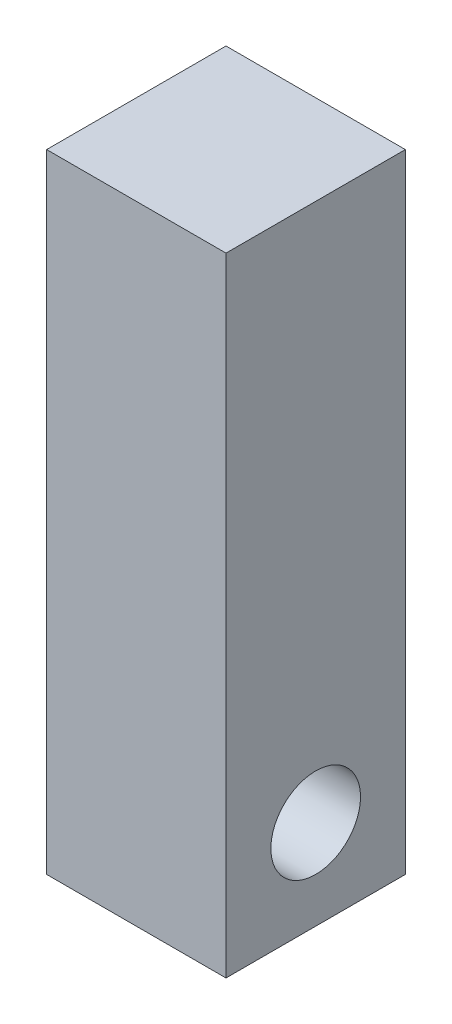
from build123d import *

# Parameters (mm, degrees)
SKETCH1_W           = 25.4
SKETCH1_H           = 25.4
BOSS_EXTRUDE1_DEPTH = 88.9
SKETCH2_R           = 6.35
CUT_EXTRUDE1_DEPTH  = 94.3255592


with BuildPart() as part:
    # Sketch1 → Boss-Extrude1 (new body)
    with BuildSketch(Plane(origin=(0, 0, 0), x_dir=(1, 0, 0), z_dir=(0, 1, 0))):
        Rectangle(SKETCH1_W, SKETCH1_H)
    extrude(amount=BOSS_EXTRUDE1_DEPTH)

    # Sketch2 → Cut-Extrude1 (cut, through all)
    with BuildSketch(Plane(origin=(12.7, 0, 0), x_dir=(0, 0, -1), z_dir=(1, 0, 0))):
        with Locations((0, 12.7)):
            Circle(SKETCH2_R)
    extrude(amount=-CUT_EXTRUDE1_DEPTH, mode=Mode.SUBTRACT)


solid = part.part
